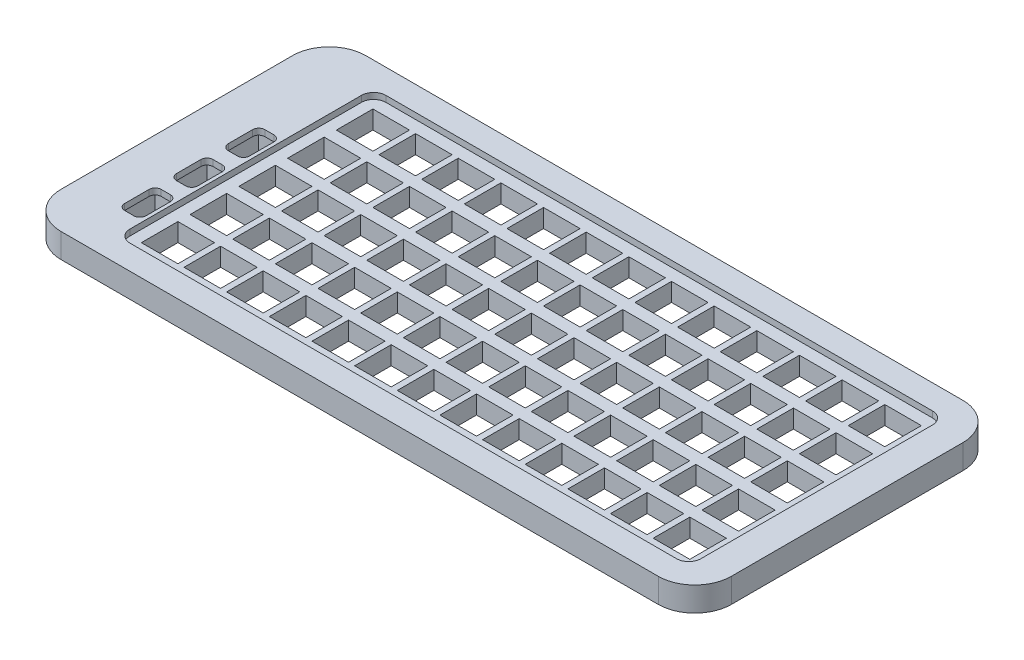
from build123d import *

# Parameters (mm, degrees)
SKETCH_1_W          = 110
SKETCH_1_H          = 50
EXTRUDE_1_DEPTH     = 3
SKETCH_2_W          = 6
SKETCH_2_H          = 6
CUT_EXTRUDE_1_DEPTH = 10
SKETCH_3_W          = 110
SKETCH_3_H          = 50
SKETCH_3_W_2        = 93.7
SKETCH_3_H_2        = 42
EXTRUDE_2_DEPTH     = 1
FILLET_1_R          = 6
CUT_EXTRUDE_2_DEPTH = 6
SKETCH_5_W          = 4.5
SKETCH_5_H          = 7
CUT_EXTRUDE_3_DEPTH = 3
FILLET_2_R          = 2


with BuildPart() as part:
    # 草图1 → 凸台-拉伸1 (new body)
    with BuildSketch(Plane(origin=(0, 0, 0), x_dir=(1, 0, 0), z_dir=(0, 1, 0))):
        Rectangle(SKETCH_1_W, SKETCH_1_H)
    extrude(amount=EXTRUDE_1_DEPTH)

    # 草图2 → 切除-拉伸1 (cut)
    with BuildSketch(Plane.XZ):
        with Locations((45.1750889, 8.00003429)):
            Rectangle(SKETCH_2_W, SKETCH_2_H)
        with Locations((45.1750889, 16.00003429)):
            Rectangle(SKETCH_2_W, SKETCH_2_H)
        with Locations((45.1750889, 3.429e-05)):
            Rectangle(SKETCH_2_W, SKETCH_2_H)
        with Locations((45.1750889, -7.99996571)):
            Rectangle(SKETCH_2_W, SKETCH_2_H)
        with Locations((45.1750889, -15.99996571)):
            Rectangle(SKETCH_2_W, SKETCH_2_H)
        with Locations((38.1750889, 8.00003429)):
            Rectangle(SKETCH_2_W, SKETCH_2_H)
        with Locations((38.1750889, 3.429e-05)):
            Rectangle(SKETCH_2_W, SKETCH_2_H)
        with Locations((38.1750889, -7.99996571)):
            Rectangle(SKETCH_2_W, SKETCH_2_H)
        with Locations((38.1750889, -15.99996571)):
            Rectangle(SKETCH_2_W, SKETCH_2_H)
        with Locations((31.1750889, 8.00003429)):
            Rectangle(SKETCH_2_W, SKETCH_2_H)
        with Locations((31.1750889, 3.429e-05)):
            Rectangle(SKETCH_2_W, SKETCH_2_H)
        with Locations((31.1750889, -7.99996571)):
            Rectangle(SKETCH_2_W, SKETCH_2_H)
        with Locations((31.1750889, -15.99996571)):
            Rectangle(SKETCH_2_W, SKETCH_2_H)
        with Locations((24.1750889, 8.00003429)):
            Rectangle(SKETCH_2_W, SKETCH_2_H)
        with Locations((24.1750889, 3.429e-05)):
            Rectangle(SKETCH_2_W, SKETCH_2_H)
        with Locations((24.1750889, -7.99996571)):
            Rectangle(SKETCH_2_W, SKETCH_2_H)
        with Locations((24.1750889, -15.99996571)):
            Rectangle(SKETCH_2_W, SKETCH_2_H)
        with Locations((17.1750889, 8.00003429)):
            Rectangle(SKETCH_2_W, SKETCH_2_H)
        with Locations((17.1750889, 3.429e-05)):
            Rectangle(SKETCH_2_W, SKETCH_2_H)
        with Locations((17.1750889, -7.99996571)):
            Rectangle(SKETCH_2_W, SKETCH_2_H)
        with Locations((17.1750889, -15.99996571)):
            Rectangle(SKETCH_2_W, SKETCH_2_H)
        with Locations((10.1750889, 8.00003429)):
            Rectangle(SKETCH_2_W, SKETCH_2_H)
        with Locations((10.1750889, 3.429e-05)):
            Rectangle(SKETCH_2_W, SKETCH_2_H)
        with Locations((10.1750889, -7.99996571)):
            Rectangle(SKETCH_2_W, SKETCH_2_H)
        with Locations((10.1750889, -15.99996571)):
            Rectangle(SKETCH_2_W, SKETCH_2_H)
        with Locations((3.1750889, 8.00003429)):
            Rectangle(SKETCH_2_W, SKETCH_2_H)
        with Locations((3.1750889, 3.429e-05)):
            Rectangle(SKETCH_2_W, SKETCH_2_H)
        with Locations((3.1750889, -7.99996571)):
            Rectangle(SKETCH_2_W, SKETCH_2_H)
        with Locations((3.1750889, -15.99996571)):
            Rectangle(SKETCH_2_W, SKETCH_2_H)
        with Locations((-3.8249111, 8.00003429)):
            Rectangle(SKETCH_2_W, SKETCH_2_H)
        with Locations((-3.8249111, 3.429e-05)):
            Rectangle(SKETCH_2_W, SKETCH_2_H)
        with Locations((-3.8249111, -7.99996571)):
            Rectangle(SKETCH_2_W, SKETCH_2_H)
        with Locations((-3.8249111, -15.99996571)):
            Rectangle(SKETCH_2_W, SKETCH_2_H)
        with Locations((-10.8249111, 8.00003429)):
            Rectangle(SKETCH_2_W, SKETCH_2_H)
        with Locations((-10.8249111, 3.429e-05)):
            Rectangle(SKETCH_2_W, SKETCH_2_H)
        with Locations((-10.8249111, -7.99996571)):
            Rectangle(SKETCH_2_W, SKETCH_2_H)
        with Locations((-10.8249111, -15.99996571)):
            Rectangle(SKETCH_2_W, SKETCH_2_H)
        with Locations((-17.8249111, 8.00003429)):
            Rectangle(SKETCH_2_W, SKETCH_2_H)
        with Locations((-17.8249111, 3.429e-05)):
            Rectangle(SKETCH_2_W, SKETCH_2_H)
        with Locations((-17.8249111, -7.99996571)):
            Rectangle(SKETCH_2_W, SKETCH_2_H)
        with Locations((-17.8249111, -15.99996571)):
            Rectangle(SKETCH_2_W, SKETCH_2_H)
        with Locations((-24.8249111, 8.00003429)):
            Rectangle(SKETCH_2_W, SKETCH_2_H)
        with Locations((-24.8249111, 3.429e-05)):
            Rectangle(SKETCH_2_W, SKETCH_2_H)
        with Locations((-24.8249111, -7.99996571)):
            Rectangle(SKETCH_2_W, SKETCH_2_H)
        with Locations((-24.8249111, -15.99996571)):
            Rectangle(SKETCH_2_W, SKETCH_2_H)
        with Locations((-31.8249111, 8.00003429)):
            Rectangle(SKETCH_2_W, SKETCH_2_H)
        with Locations((-31.8249111, 3.429e-05)):
            Rectangle(SKETCH_2_W, SKETCH_2_H)
        with Locations((-31.8249111, -7.99996571)):
            Rectangle(SKETCH_2_W, SKETCH_2_H)
        with Locations((-31.8249111, -15.99996571)):
            Rectangle(SKETCH_2_W, SKETCH_2_H)
        with Locations((-38.8249111, 8.00003429)):
            Rectangle(SKETCH_2_W, SKETCH_2_H)
        with Locations((-38.8249111, 3.429e-05)):
            Rectangle(SKETCH_2_W, SKETCH_2_H)
        with Locations((-38.8249111, -7.99996571)):
            Rectangle(SKETCH_2_W, SKETCH_2_H)
        with Locations((-38.8249111, -15.99996571)):
            Rectangle(SKETCH_2_W, SKETCH_2_H)
        with Locations((38.1750889, 16.00003429)):
            Rectangle(SKETCH_2_W, SKETCH_2_H)
        with Locations((31.1750889, 16.00003429)):
            Rectangle(SKETCH_2_W, SKETCH_2_H)
        with Locations((24.1750889, 16.00003429)):
            Rectangle(SKETCH_2_W, SKETCH_2_H)
        with Locations((17.1750889, 16.00003429)):
            Rectangle(SKETCH_2_W, SKETCH_2_H)
        with Locations((10.1750889, 16.00003429)):
            Rectangle(SKETCH_2_W, SKETCH_2_H)
        with Locations((3.1750889, 16.00003429)):
            Rectangle(SKETCH_2_W, SKETCH_2_H)
        with Locations((-3.8249111, 16.00003429)):
            Rectangle(SKETCH_2_W, SKETCH_2_H)
        with Locations((-10.8249111, 16.00003429)):
            Rectangle(SKETCH_2_W, SKETCH_2_H)
        with Locations((-17.8249111, 16.00003429)):
            Rectangle(SKETCH_2_W, SKETCH_2_H)
        with Locations((-24.8249111, 16.00003429)):
            Rectangle(SKETCH_2_W, SKETCH_2_H)
        with Locations((-31.8249111, 16.00003429)):
            Rectangle(SKETCH_2_W, SKETCH_2_H)
        with Locations((-38.8249111, 16.00003429)):
            Rectangle(SKETCH_2_W, SKETCH_2_H)
    extrude(amount=-CUT_EXTRUDE_1_DEPTH, mode=Mode.SUBTRACT)

    # 草图3 → 凸台-拉伸2 (add)
    with BuildSketch(Plane(origin=(0, 3, 0), x_dir=(1, 0, 0), z_dir=(0, 1, 0))):
        Rectangle(SKETCH_3_W, SKETCH_3_H)
        with Locations((3.15, 0)):
            Rectangle(SKETCH_3_W_2, SKETCH_3_H_2, mode=Mode.SUBTRACT)
    extrude(amount=EXTRUDE_2_DEPTH)

    # 圆角1
    fillet_1_edges = [part.edges().sort_by_distance(p)[0] for p in [
        (-55, 2, -25),
        (-55, 2, 25),
        (55, 2, 25),
        (55, 2, -25),
    ]]
    fillet(fillet_1_edges, radius=FILLET_1_R)

    # 草图4 → 切除-拉伸2 (cut)
    with BuildSketch(Plane.XZ):
        with BuildLine():
            Line((-45.261201687, -0.20000635), (-46.761201687, -0.20000635))
            ThreePointArc((-46.761201687, -0.20000635), (-47.468308468, -0.492899569), (-47.761201687, -1.20000635))
            Line((-47.761201687, -1.20000635), (-47.761201687, -5.20000635))
            ThreePointArc((-47.761201687, -5.20000635), (-47.468308468, -5.907113131), (-46.761201687, -6.20000635))
            Line((-46.761201687, -6.20000635), (-45.261201687, -6.20000635))
            ThreePointArc((-45.261201687, -6.20000635), (-44.554094906, -5.907113131), (-44.261201687, -5.20000635))
            Line((-44.261201687, -5.20000635), (-44.261201687, -1.20000635))
            ThreePointArc((-44.261201687, -1.20000635), (-44.554094906, -0.492899569), (-45.261201687, -0.20000635))
        make_face()
        with BuildLine():
            Line((-44.261201687, 7.29999365), (-44.261201687, 3.29999365))
            ThreePointArc((-44.261201687, 3.29999365), (-44.554094906, 2.592886869), (-45.261201687, 2.29999365))
            Line((-45.261201687, 2.29999365), (-46.761201687, 2.29999365))
            ThreePointArc((-46.761201687, 2.29999365), (-47.468308468, 2.592886869), (-47.761201687, 3.29999365))
            Line((-47.761201687, 3.29999365), (-47.761201687, 7.29999365))
            ThreePointArc((-47.761201687, 7.29999365), (-47.468308468, 8.007100431), (-46.761201687, 8.29999365))
            Line((-46.761201687, 8.29999365), (-45.261201687, 8.29999365))
            ThreePointArc((-45.261201687, 8.29999365), (-44.554094906, 8.007100431), (-44.261201687, 7.29999365))
        make_face()
        with BuildLine():
            Line((-44.261201687, 15.79999365), (-44.261201687, 11.79999365))
            ThreePointArc((-44.261201687, 11.79999365), (-44.554094906, 11.092886869), (-45.261201687, 10.79999365))
            Line((-45.261201687, 10.79999365), (-46.761201687, 10.79999365))
            ThreePointArc((-46.761201687, 10.79999365), (-47.468308468, 11.092886869), (-47.761201687, 11.79999365))
            Line((-47.761201687, 11.79999365), (-47.761201687, 15.79999365))
            ThreePointArc((-47.761201687, 15.79999365), (-47.468308468, 16.507100431), (-46.761201687, 16.79999365))
            Line((-46.761201687, 16.79999365), (-45.261201687, 16.79999365))
            ThreePointArc((-45.261201687, 16.79999365), (-44.554094906, 16.507100431), (-44.261201687, 15.79999365))
        make_face()
    extrude(amount=-CUT_EXTRUDE_2_DEPTH, mode=Mode.SUBTRACT)

    # 草图5 → 切除-拉伸3 (cut)
    with BuildSketch(Plane.XZ):
        with Locations((-46.011201687, 5.29999365)):
            Rectangle(SKETCH_5_W, SKETCH_5_H)
        with Locations((-46.011201687, -3.20000635)):
            Rectangle(SKETCH_5_W, SKETCH_5_H)
        with Locations((-46.011201687, 13.79999365)):
            Rectangle(SKETCH_5_W, SKETCH_5_H)
    extrude(amount=-CUT_EXTRUDE_3_DEPTH, mode=Mode.SUBTRACT)

    # 圆角2
    fillet_2_edges = [part.edges().sort_by_distance(p)[0] for p in [
        (50, 3.5, 21),
        (50, 3.5, -21),
        (-43.7, 3.5, -21),
        (-43.7, 3.5, 21),
    ]]
    fillet(fillet_2_edges, radius=FILLET_2_R)


solid = part.part
